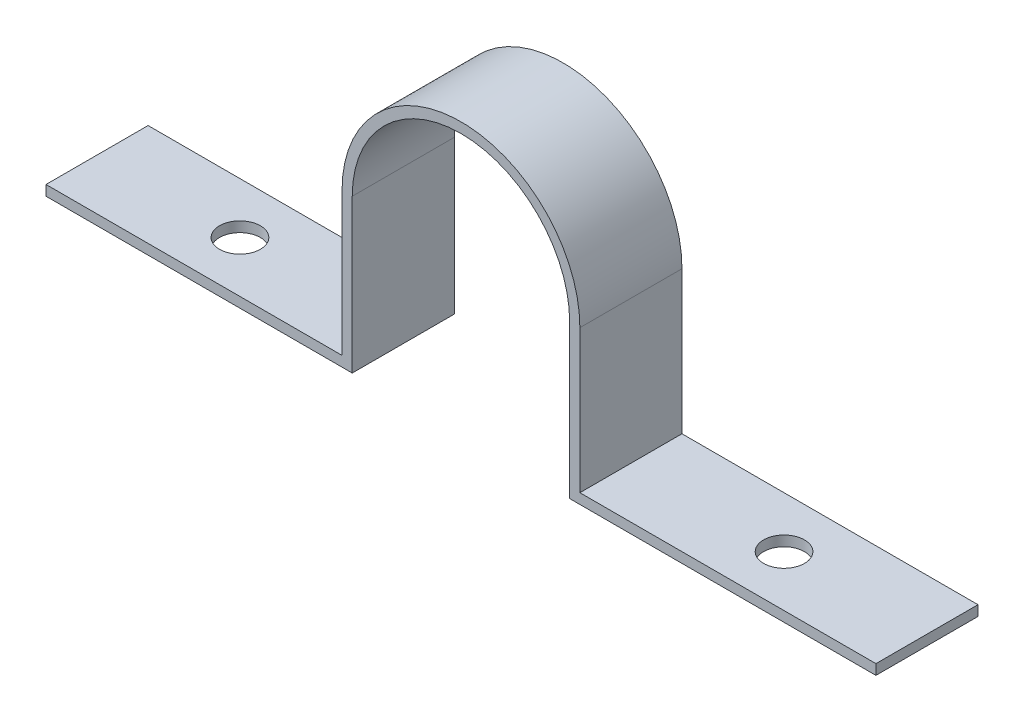
from build123d import *

# Parameters (mm, degrees)
SALIENTE_EXTRUIR1_DEPTH = 10
CROQUIS2_R              = 2
CORTAR_EXTRUIR1_DEPTH   = 10


with BuildPart() as part:
    # Croquis1 → Saliente-Extruir1 (new body)
    with BuildSketch(Plane.XY):
        with BuildLine():
            Line((10.65, 0), (10.65, -15))
            Line((10.65, -15), (40.65, -15))
            Line((40.65, -15), (40.65, -14))
            Line((40.65, -14), (39.65, -14))
            Line((39.65, -14), (11.65, -14))
            Line((11.65, -14), (11.65, 0))
            ThreePointArc((11.65, 0), (0, 11.65), (-11.65, 0))
            Line((-11.65, 0), (-11.65, -14))
            Line((-11.65, -14), (-39.65, -14))
            Line((-39.65, -14), (-40.65, -14))
            Line((-40.65, -14), (-40.65, -15))
            Line((-40.65, -15), (-10.65, -15))
            Line((-10.65, -15), (-10.65, 0))
            ThreePointArc((-10.65, 0), (0, 10.65), (10.65, 0))
        make_face()
    extrude(amount=SALIENTE_EXTRUIR1_DEPTH)

    # Croquis2 → Cortar-Extruir1 (cut)
    with BuildSketch(Plane(origin=(0, -16.507351352, 0), x_dir=(1, 0, 0), z_dir=(0, 1, 0))):
        with Locations((-26.65, -5)):
            Circle(CROQUIS2_R)
        with Locations((26.65, -5)):
            Circle(CROQUIS2_R)
    extrude(amount=CORTAR_EXTRUIR1_DEPTH, mode=Mode.SUBTRACT)


solid = part.part
